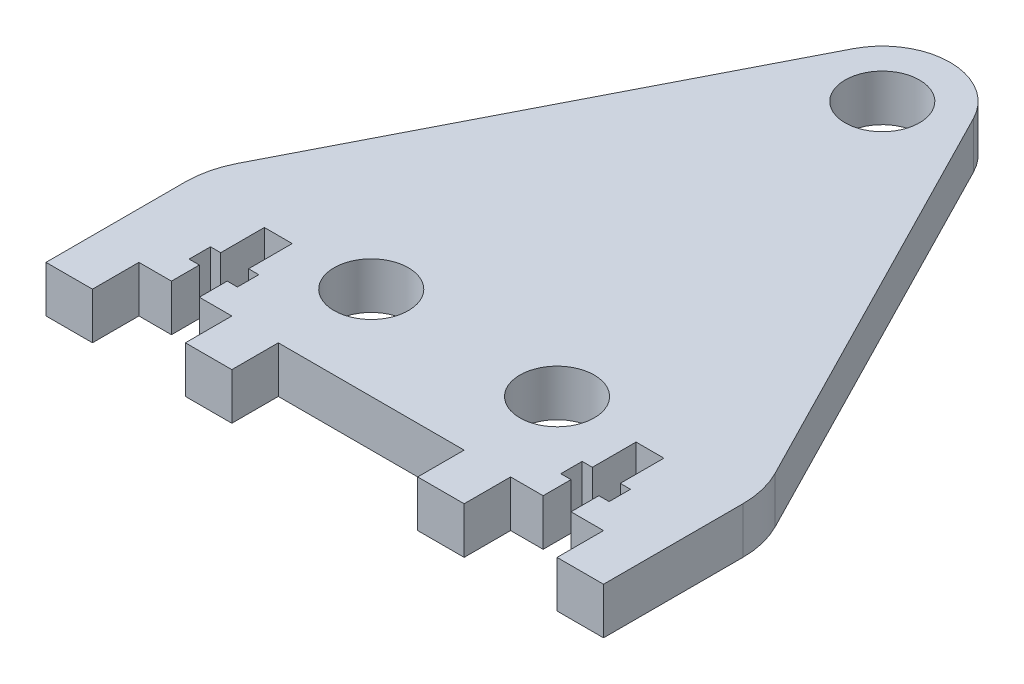
from build123d import *

# Parameters (mm, degrees)
SKETCH1_R           = 4
BOSS_EXTRUDE1_DEPTH = 5


with BuildPart() as part:
    # Sketch1 → Boss-Extrude1 (new body)
    with BuildSketch(Plane(origin=(0, 0, 0), x_dir=(1, 0, 0), z_dir=(0, 1, 0))):
        with BuildLine():
            Line((-30, 10), (-30, -5))
            Line((-30, -5), (-25, -5))
            Line((-25, -5), (-25, 0))
            Line((-25, 0), (-21.5, 0))
            Line((-21.5, 0), (-21.5, 3))
            Line((-21.5, 3), (-22.6, 3))
            Line((-22.6, 3), (-22.6, 5.3))
            Line((-22.6, 5.3), (-21.5, 5.3))
            Line((-21.5, 5.3), (-21.5, 10))
            Line((-21.5, 10), (-18.5, 10))
            Line((-18.5, 10), (-18.5, 5.3))
            Line((-18.5, 5.3), (-17.4, 5.3))
            Line((-17.4, 5.3), (-17.4, 3))
            Line((-17.4, 3), (-18.5, 3))
            Line((-18.5, 3), (-18.5, 0))
            Line((-18.5, 0), (-15, 0))
            Line((-15, 0), (-15, -5))
            Line((-15, -5), (-10, -5))
            Line((-10, -5), (-10, 0))
            Line((-10, 0), (10, 0))
            Line((10, 0), (10, -5))
            Line((10, -5), (15, -5))
            Line((15, -5), (15, 0))
            Line((15, 0), (18.5, 0))
            Line((18.5, 0), (18.5, 3))
            Line((18.5, 3), (17.4, 3))
            Line((17.4, 3), (17.4, 5.3))
            Line((17.4, 5.3), (18.5, 5.3))
            Line((18.5, 5.3), (18.5, 10))
            Line((18.5, 10), (21.5, 10))
            Line((21.5, 10), (21.5, 5.3))
            Line((21.5, 5.3), (22.6, 5.3))
            Line((22.6, 5.3), (22.6, 3))
            Line((22.6, 3), (21.5, 3))
            Line((21.5, 3), (21.5, 0))
            Line((21.5, 0), (25, 0))
            Line((25, 0), (25, -5))
            Line((25, -5), (30, -5))
            Line((30, -5), (30, 10))
            ThreePointArc((30, 10), (29.721396184, 12.344025646), (28.901108754, 14.557440395))
            Line((28.901108754, 14.557440395), (6.492233497, 58.324076585))
            ThreePointArc((6.492233497, 58.324076585), (0, 62.293735732), (-6.492233497, 58.324076585))
            Line((-6.492233497, 58.324076585), (-28.901108754, 14.557440395))
            ThreePointArc((-28.901108754, 14.557440395), (-29.721396184, 12.344025646), (-30, 10))
        make_face()
        with Locations((0, 55)):
            Circle(SKETCH1_R, mode=Mode.SUBTRACT)
        with Locations((-10, 10)):
            Circle(SKETCH1_R, mode=Mode.SUBTRACT)
        with Locations((10, 10)):
            Circle(SKETCH1_R, mode=Mode.SUBTRACT)
    extrude(amount=BOSS_EXTRUDE1_DEPTH)


solid = part.part
